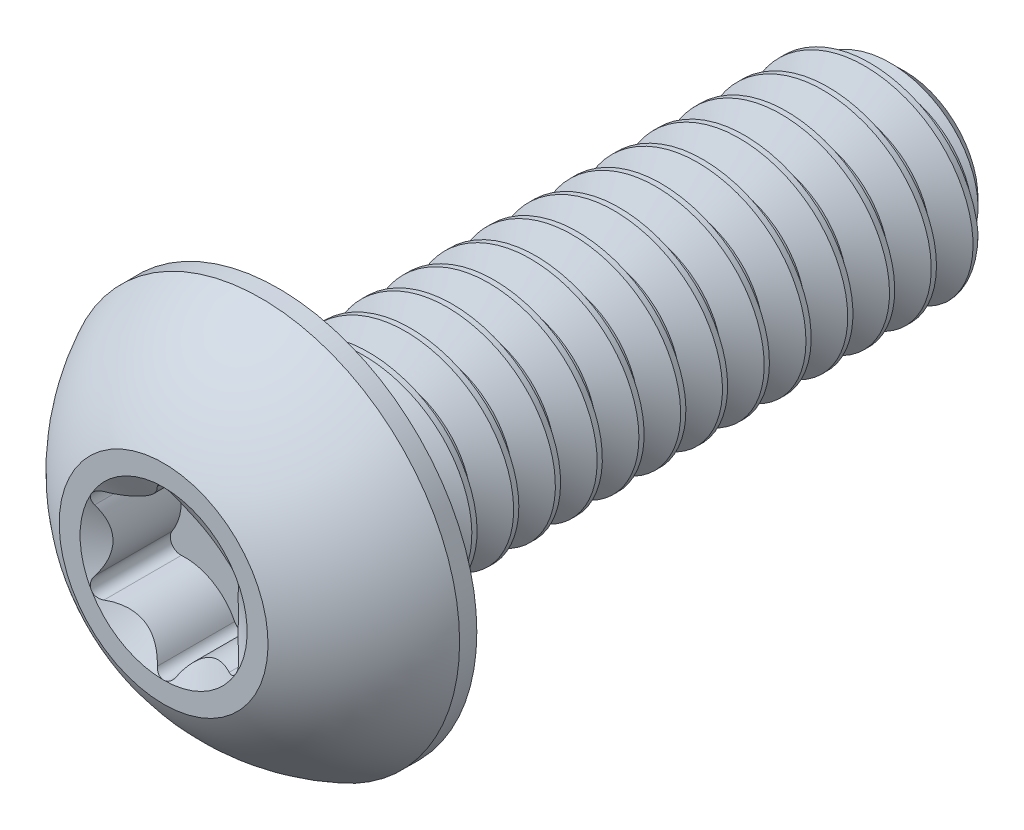
from build123d import *

# Parameters (mm, degrees)
SKETCH1_W          = 6
SKETCH1_H          = 1
CHAMFER1_SIZE      = 0.3
CUT_SWEEP1_PITCH   = 0.4
CUT_EXTRUDE2_DEPTH = 0.77
CIRPATTERN1_COUNT  = 6


with BuildPart() as part:
    # Sketch1 → Revolve1 (revolve)
    with BuildSketch(Plane(origin=(0, 0, 0), x_dir=(0, 0, -1), z_dir=(1, 0, 0))):
        with Locations((4.1, 0.5)):
            Rectangle(SKETCH1_W, SKETCH1_H)
    revolve(axis=Axis((0, 0, -7.1), (0, 0, 1)))

    # Chamfer1
    chamfer1_edges = [part.edges().sort_by_distance(p)[0] for p in [
        (0, -1, -7.1),
    ]]
    chamfer(chamfer1_edges, length=CHAMFER1_SIZE)

    # Cut-Sweep1: the profile of Sketch2 profile screwed along a right-hand helix of 16 turns, 6 arcs to a turn; built about Z, then put on its axis
    cut_sweep1_z = Axis((0, 0, 0), (0, 0, 1))
    cut_sweep1_corners = [(1.0003, 0, 0.000173205), (1.0003, 0, -0.350173205), (0.740192379, 0, -0.2), (0.740192379, 0, -0.15)]
    with BuildLine(mode=Mode.PRIVATE) as cut_sweep1_profile:
        Line(cut_sweep1_corners[0], cut_sweep1_corners[1])
        Line(cut_sweep1_corners[1], cut_sweep1_corners[2])
        Line(cut_sweep1_corners[2], cut_sweep1_corners[3])
        Line(cut_sweep1_corners[3], cut_sweep1_corners[0])
    cut_sweep1_cap = Face(cut_sweep1_profile.wire())
    cut_sweep1_turn_angles = [0, 30, 60, 90, 120, 150, 180, 210, 240, 270, 300, 330, 360]
    cut_sweep1_turn_weights = [1, 0.8660254037844387, 1, 0.8660254037844387, 1, 0.8660254037844387, 1, 0.8660254037844387, 1, 0.8660254037844387, 1, 0.8660254037844387, 1]
    cut_sweep1_turn_rails = [Edge.make_bspline([Vector(p[0], p[1], 0).rotate(cut_sweep1_z, cut_sweep1_turn_angles[k]) / cut_sweep1_turn_weights[k] + Vector(0, 0, p[2] + CUT_SWEEP1_PITCH * cut_sweep1_turn_angles[k] / 360) for k in range(13)], [0, 0, 0, 1, 1, 2, 2, 3, 3, 4, 4, 5, 5, 6, 6, 6], 2, cut_sweep1_turn_weights) for p in cut_sweep1_corners]
    cut_sweep1_turn_sides = [Face.make_surface_from_curves(cut_sweep1_turn_rails[p[0]], cut_sweep1_turn_rails[p[1]]) for p in [(0, 1), (1, 2), (2, 3), (3, 0)]]
    cut_sweep1 = Plane(origin=(0, 0, -7.1), x_dir=(0, 1, 0), z_dir=(0, 0, 1)) * Solid(Shell([*[p.moved(Location((0, 0, CUT_SWEEP1_PITCH * i))) for i in range(16) for p in cut_sweep1_turn_sides], cut_sweep1_cap, cut_sweep1_cap.rotate(cut_sweep1_z, 5760).moved(Location((0, 0, CUT_SWEEP1_PITCH * 5760 / 360)))]))
    add(cut_sweep1, mode=Mode.SUBTRACT)

    # Sketch7 → Revolve2 (revolve)
    with BuildSketch(Plane(origin=(0, 0, 0), x_dir=(0, 0, -1), z_dir=(1, 0, 0)), mode=Mode.PRIVATE) as revolve2_sk:
        with BuildLine():
            Line((0.935, 1.9), (1.1, 1.9))
            Line((1.1, 1.9), (1.1, 0))
            Line((1.1, 0), (0, 0))
            Line((0, 0), (0, 1))
            ThreePointArc((0, 1), (0.396750073, 1.523501313), (0.935, 1.9))
        make_face()
    revolve(revolve2_sk.sketch.rotate(Axis((0, 0, 0), (0, 0, -1)), 189.336081704), axis=Axis((0, 0, 0), (0, 0, -1)))

    # Sketch5 → Cut-Extrude2 (cut)
    with BuildSketch(Plane.XY):
        with BuildLine():
            Line((0, 0), (-0.692820323, 0.4))
            ThreePointArc((-0.692820323, 0.4), (-0.706163843, 0.346715947), (-0.68935124, 0.294422772))
            ThreePointArc((-0.68935124, 0.294422772), (-0.6, 0), (-0.68935124, -0.294422772))
            ThreePointArc((-0.68935124, -0.294422772), (-0.706163843, -0.346715947), (-0.692820323, -0.4))
            Line((-0.692820323, -0.4), (0, 0))
        make_face()
    cut_extrude2 = extrude(amount=-CUT_EXTRUDE2_DEPTH, mode=Mode.SUBTRACT)

    # CirPattern1: Cut-Extrude2 ×6 about axis
    cirpattern1_axis = Axis((0, 0, 0), (0, 0, 1))
    for i in range(1, CIRPATTERN1_COUNT):
        add(cut_extrude2.rotate(cirpattern1_axis, i * 360 / CIRPATTERN1_COUNT), mode=Mode.SUBTRACT)

    # Cut-Extrude3 cone 1 section (through the dimple's axis) → Cut-Extrude3 (revolve, cut)
    with BuildSketch(Plane(origin=(0, 0, 0), x_dir=(0, -1, 0), z_dir=(1, 0, 0))):
        Polygon((0, 0), (0.8, 0), (0, 0.461880215), align=None)
    revolve(axis=Axis((0, 0, 0), (0, 0, -1)), mode=Mode.SUBTRACT)


solid = part.part
